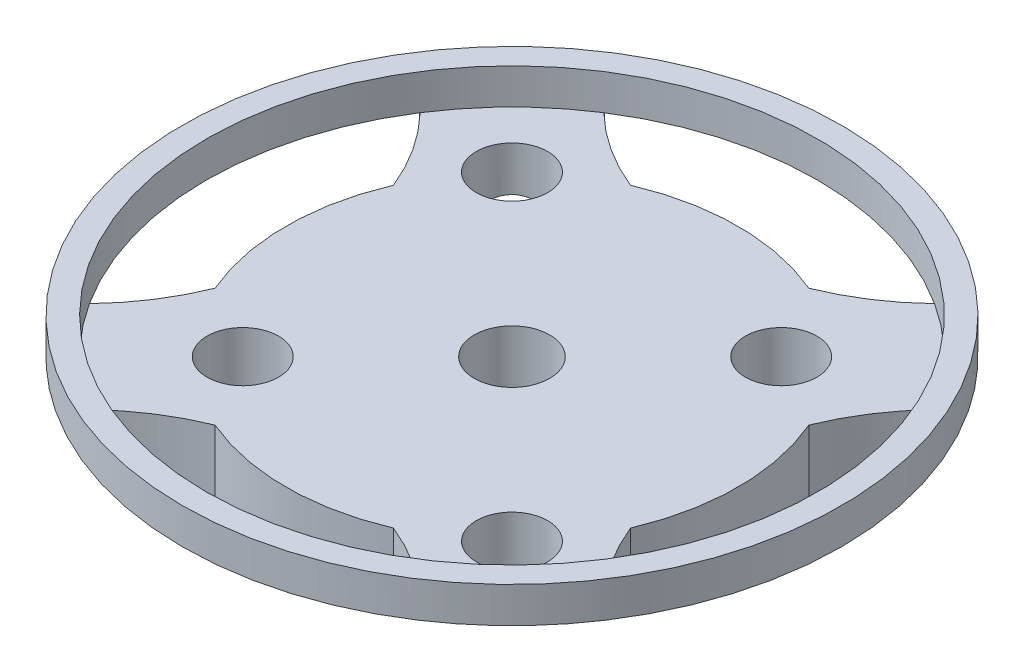
from build123d import *

# Parameters (mm, degrees)
SKETCH6_R           = 1.585
BOSS_EXTRUDE2_DEPTH = 40
SKETCH9_R           = 13.85
SKETCH9_R_2         = 12.85
BOSS_EXTRUDE3_DEPTH = 1.5
SKETCH13_R          = 1.5
CUT_EXTRUDE2_DEPTH  = 3
CUT_EXTRUDE3_START  = -40
SKETCH15_R          = 1.585
CUT_EXTRUDE3_DEPTH  = 40


with BuildPart() as part:
    # Sketch6 → Boss-Extrude2 (new body)
    with BuildSketch(Plane(origin=(0, 0, 0), x_dir=(1, 0, 0), z_dir=(0, 1, 0))):
        with Locations(Location((0, 63.567851845, 0), (0, 0, 270))):
            Circle(SKETCH6_R)
    extrude(amount=BOSS_EXTRUDE2_DEPTH)

    # Loft3: read off the stored shape, not the designer's step
    # Loft3: loft between two sections, ruled curve by curve
    loft3_from = [
        Edge.make_bspline([(8.313384779, 1.6, -58.970283628), (17.508521214, 1.6, -75.597053186), (0.881751655, 1.6, -84.792189621), (-8.313384779, 1.6, -68.165420062), (-17.508521214, 1.6, -51.538650504), (-0.881751655, 1.6, -42.343514069), (8.313384779, 1.6, -58.970283628)], [0, 0, 0, 0, 0.5, 0.5, 0.5, 1, 1, 1, 1], 3, [1, 0.333333333, 0.333333333, 1, 0.333333333, 0.333333333, 1]),
    ]
    loft3_to = [
        Edge.make_bspline([(9.59455414, 4.6, -53.579507095), (29.571243641, 4.6, -72.768615375), (10.38213536, 4.6, -92.745304876), (-9.59455414, 4.6, -73.556196595), (-29.571243641, 4.6, -54.367088315), (-10.38213536, 4.6, -34.390398814), (9.59455414, 4.6, -53.579507095)], [0, 0, 0, 0, 0.5, 0.5, 0.5, 1, 1, 1, 1], 3, [1, 0.333333333, 0.333333333, 1, 0.333333333, 0.333333333, 1]),
    ]
    loft3 = Solid(Shell([*[Face.make_surface_from_curves(loft3_from[k], loft3_to[k]) for k in range(1)], Face(Wire(loft3_from)), Face(Wire(loft3_to))]))
    add(loft3)

    # Sketch9 → Boss-Extrude3 (add)
    with BuildSketch(Plane(origin=(0, 4.6, 0), x_dir=(1, 0, 0), z_dir=(0, 1, 0))):
        with Locations(Location((0, 63.567851845, 0), (0, 0, 313.848))):
            Circle(SKETCH9_R)
        with Locations(Location((0, 63.567851845, 0), (0, 0, 270))):
            Circle(SKETCH9_R_2, mode=Mode.SUBTRACT)
    extrude(amount=BOSS_EXTRUDE3_DEPTH)

    # Sketch13 → Cut-Extrude2 (cut)
    with BuildSketch(Plane.XZ.offset(-1.6)):
        with BuildLine():
            ThreePointArc((3.748552961, -54.838685178), (5.867566996, -53.665484681), (7.642353179, -52.017226845))
            ThreePointArc((7.642353179, -52.017226845), (0, -49.717851845), (-7.642353179, -52.017226845))
            ThreePointArc((-7.642353179, -52.017226845), (-5.867566996, -53.665484681), (-3.748552962, -54.838685178))
            add(Edge.make_bspline(
                [(-3.748552962, -54.838685178), (-1.231569039, -53.757820544), (1.413224787, -53.8358287), (3.748552961, -54.838685178)],
                knots=[0.762454345, 0.762454345, 0.762454345, 0.762454345, 0.872430629, 0.872430629, 0.872430629, 0.872430629], degree=3, weights=[0.501240886, 0.508545859, 0.548103588, 0.619914072]))
        make_face()
        with BuildLine():
            ThreePointArc((-8.729166667, -59.819298884), (-9.902367164, -57.700284849), (-11.550625, -55.925498666))
            ThreePointArc((-11.550625, -55.925498666), (-13.85, -63.567851845), (-11.550625, -71.210205024))
            ThreePointArc((-11.550625, -71.210205024), (-9.902367164, -69.435418841), (-8.729166666, -67.316404806))
            add(Edge.make_bspline(
                [(-8.729166666, -67.316404806), (-9.679235061, -65.104002995), (-9.857654527, -62.447181888), (-8.729166667, -59.819298884)],
                knots=[0.523726688, 0.523726688, 0.523726688, 0.523726688, 0.664367025, 0.664367025, 0.664367025, 0.664367025], degree=3, weights=[0.909596892, 0.739873401, 0.622895787, 0.558664051]))
        make_face()
        with BuildLine():
            ThreePointArc((11.550625, -71.210205024), (13.262704405, -67.558236773), (13.85, -63.567851845))
            ThreePointArc((13.85, -63.567851845), (13.262704405, -59.577466917), (11.550625, -55.925498666))
            ThreePointArc((11.550625, -55.925498666), (9.902367164, -57.700284849), (8.729166667, -59.819298884))
            add(Edge.make_bspline(
                [(8.729166667, -59.819298884), (9.679235061, -62.031700695), (9.857654527, -64.688521802), (8.729166667, -67.316404807)],
                knots=[0.023726688, 0.023726688, 0.023726688, 0.023726688, 0.164367025, 0.164367025, 0.164367025, 0.164367025], degree=3, weights=[0.909596892, 0.739873401, 0.622895787, 0.558664051]))
            ThreePointArc((8.729166667, -67.316404807), (9.902367164, -69.435418841), (11.550625, -71.210205024))
        make_face()
        with BuildLine():
            ThreePointArc((-7.642353179, -75.118476845), (0, -77.417851845), (7.642353179, -75.118476845))
            ThreePointArc((7.642353179, -75.118476845), (5.867566996, -73.470219009), (3.748552961, -72.297018512))
            add(Edge.make_bspline(
                [(3.748552961, -72.297018512), (1.231569039, -73.377883146), (-1.413224786, -73.29987499), (-3.748552961, -72.297018512)],
                knots=[0.262454345, 0.262454345, 0.262454345, 0.262454345, 0.372430629, 0.372430629, 0.372430629, 0.372430629], degree=3, weights=[0.501240886, 0.508545859, 0.548103588, 0.619914071]))
            ThreePointArc((-3.748552961, -72.297018512), (-5.867566996, -73.470219009), (-7.642353179, -75.118476845))
        make_face()
        with Locations(Location((-5.656854249, -57.910997596, 0), (0, 0, 270))):
            Circle(SKETCH13_R)
        with Locations(Location((6.717514421, -56.850337424, 0), (0, 0, 270))):
            Circle(SKETCH13_R)
        with Locations(Location((5.656854249, -69.224706095, 0), (0, 0, 270))):
            Circle(SKETCH13_R)
        with Locations(Location((-6.717514421, -70.285366266, 0), (0, 0, 270))):
            Circle(SKETCH13_R)
    extrude(amount=-CUT_EXTRUDE2_DEPTH, mode=Mode.SUBTRACT)

    # Sketch15 → Cut-Extrude3 (cut)
    with BuildSketch(Plane(origin=(0, 40, 0), x_dir=(1, 0, 0), z_dir=(0, 1, 0)).offset(CUT_EXTRUDE3_START)):
        with Locations(Location((0, 63.567851845, 0), (0, 0, 270))):
            Circle(SKETCH15_R)
    extrude(amount=CUT_EXTRUDE3_DEPTH, mode=Mode.SUBTRACT)


solid = part.part
